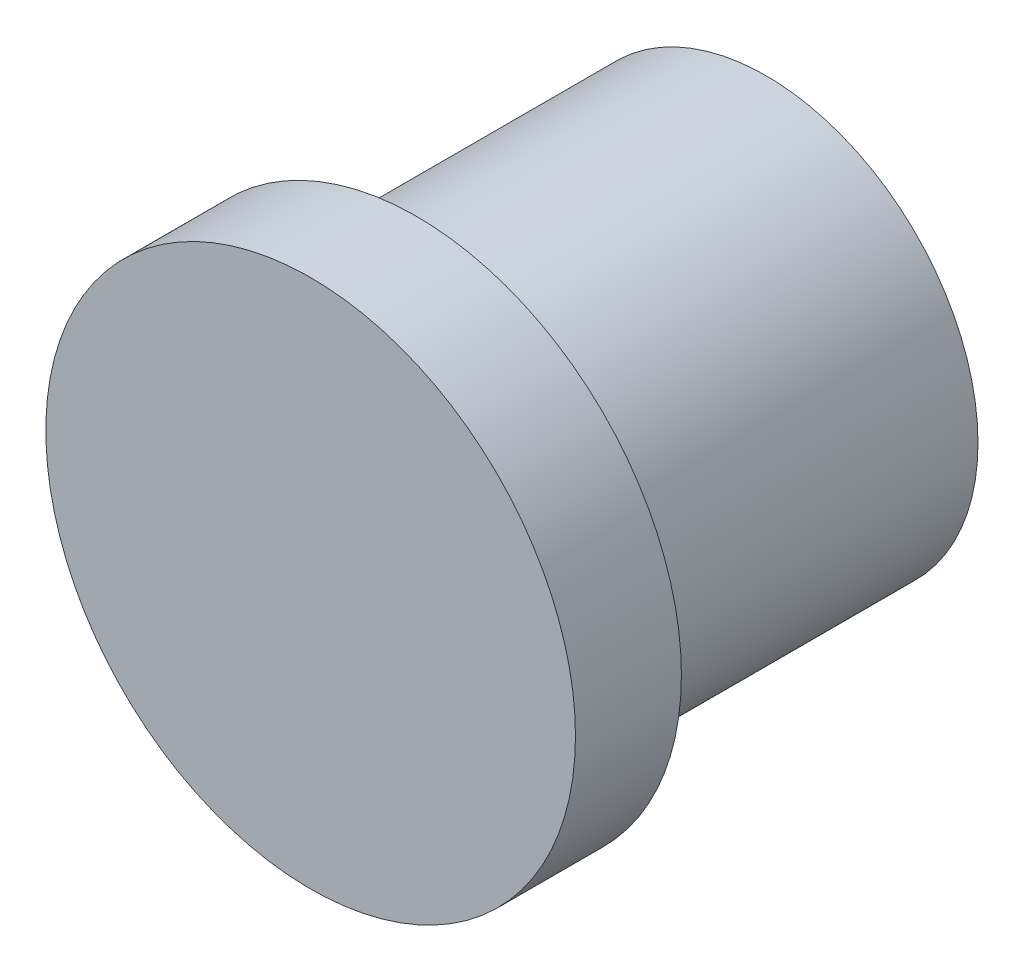
from build123d import *

# Parameters (mm, degrees)
CROQUIS1_R              = 20
SALIENTE_EXTRUIR2_DEPTH = 21.5
CROQUIS3_R              = 25
CROQUIS3_R_2            = 20
SALIENTE_EXTRUIR3_DEPTH = 10


with BuildPart() as part:
    # Croquis1 → Saliente-Extruir2 (new, symmetric)
    with BuildSketch(Plane.XY):
        Circle(CROQUIS1_R)
    extrude(amount=SALIENTE_EXTRUIR2_DEPTH, both=True)

    # Croquis3 → Saliente-Extruir3 (add)
    with BuildSketch(Plane.XY.offset(21.5)):
        Circle(CROQUIS3_R)
        Circle(CROQUIS3_R_2, mode=Mode.SUBTRACT)
    extrude(amount=-SALIENTE_EXTRUIR3_DEPTH)


solid = part.part
